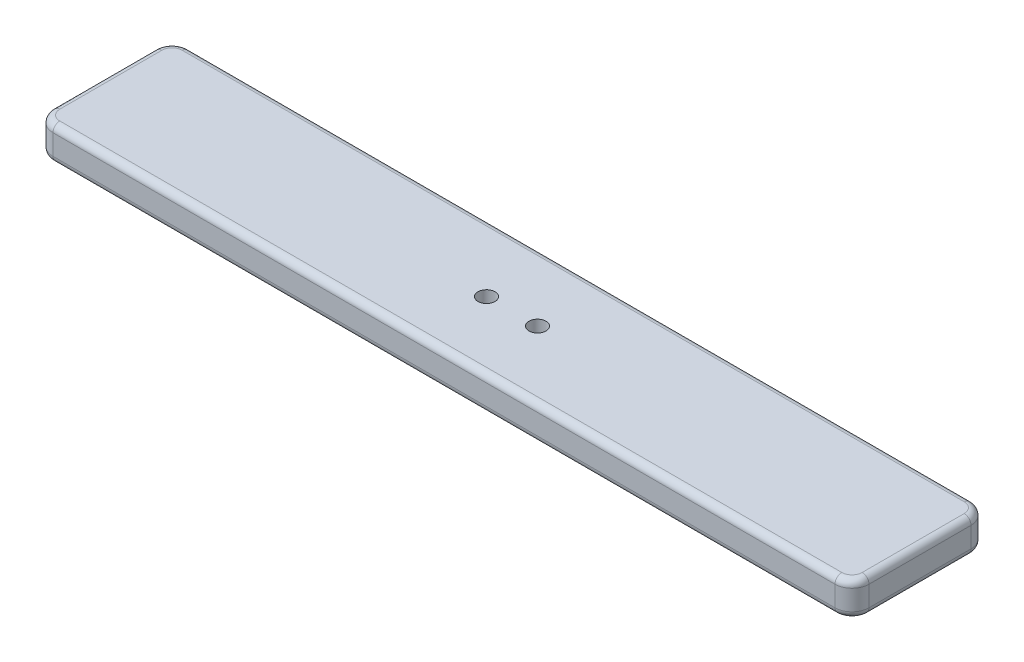
from build123d import *

# Parameters (mm, degrees)
SKETCH1_W           = 304.8
SKETCH1_H           = 50.8
BOSS_EXTRUDE1_DEPTH = 12.7
FILLET1_R           = 6.35
FILLET2_R           = 2.54
SKETCH2_R           = 3.175
CUT_EXTRUDE1_DEPTH  = 310.265209812


with BuildPart() as part:
    # Sketch1 → Boss-Extrude1 (new body)
    with BuildSketch(Plane(origin=(0, 0, 0), x_dir=(1, 0, 0), z_dir=(0, 1, 0))):
        with Locations((152.4, 25.4)):
            Rectangle(SKETCH1_W, SKETCH1_H)
    extrude(amount=BOSS_EXTRUDE1_DEPTH)

    # Fillet1
    fillet1_edges = [part.edges().sort_by_distance(p)[0] for p in [
        (304.8, 6.35, -50.8),
        (304.8, 6.35, 0),
        (0, 6.35, -50.8),
        (0, 6.35, 0),
    ]]
    fillet(fillet1_edges, radius=FILLET1_R)

    # Fillet2
    fillet2_edges = [part.edges().sort_by_distance(p)[0] for p in [
        (1.859871939, 0, -48.940128061),
        (0, 0, -25.4),
        (1.859871939, 0, -1.859871939),
        (152.4, 0, 0),
        (302.940128061, 0, -1.859871939),
        (304.8, 0, -25.4),
        (302.940128061, 0, -48.940128061),
        (152.4, 0, -50.8),
        (302.940128061, 12.7, -1.859871939),
        (152.4, 12.7, 0),
        (1.859871939, 12.7, -1.859871939),
        (0, 12.7, -25.4),
        (1.859871939, 12.7, -48.940128061),
        (152.4, 12.7, -50.8),
        (302.940128061, 12.7, -48.940128061),
        (304.8, 12.7, -25.4),
    ]]
    fillet(fillet2_edges, radius=FILLET2_R)

    # Sketch2 → Cut-Extrude1 (cut, through all)
    with BuildSketch(Plane(origin=(0, 12.7, 0), x_dir=(1, 0, 0), z_dir=(0, 1, 0))):
        with Locations((142.875, 25.4)):
            Circle(SKETCH2_R)
        with Locations((161.925, 25.4)):
            Circle(SKETCH2_R)
    extrude(amount=-CUT_EXTRUDE1_DEPTH, mode=Mode.SUBTRACT)


solid = part.part
